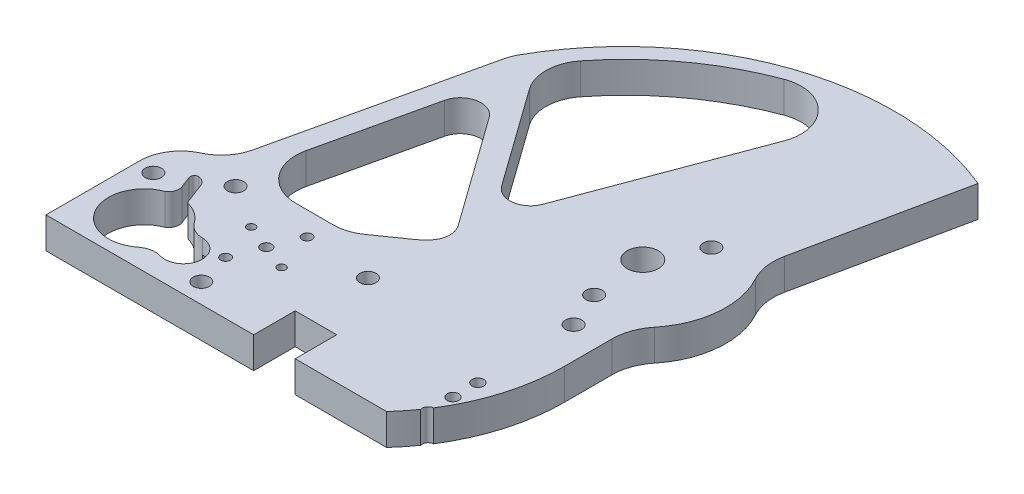
from build123d import *

# Parameters (mm, degrees)
SKETCH1_R                = 4.7625
SKETCH1_W                = 139.7
SKETCH1_H                = 38.1
BOSS_EXTRUDE1_DEPTH      = 9.525
CUT_EXTRUDE4_DEPTH       = 106.62050594
CUT_EXTRUDE4_DEPTH_BACK  = 106.62050594
SKETCH5_W                = 20.32
SKETCH5_H                = 77.381530754
FILLET9_R                = 12.7
BOSS_EXTRUDE4_DEPTH      = 9.525
CUT_EXTRUDE3_DEPTH       = 153.280394257
CUT_EXTRUDE3_DEPTH_BACK  = 153.280394257
SKETCH4_R                = 10.9728
FILLET13_R               = 12.7
FILLET14_R               = 6.35
CUT_EXTRUDE5_DEPTH       = 153.280394397
CUT_EXTRUDE5_DEPTH_BACK  = 153.280394397
SKETCH7_W                = 12.7
SKETCH7_H                = 6.35
FILLET15_R               = 1.27
SKETCH8_W                = 59.69
SKETCH8_H                = 3.175
SKETCH8_W_2              = 12.7
BOSS_EXTRUDE5_DEPTH      = 9.525
SKETCH9_R                = 14.2875
CUT_EXTRUDE6_DEPTH       = 5.08
CUT_EXTRUDE7_DEPTH       = 153.067088129
CUT_EXTRUDE7_DEPTH_BACK  = 153.067088129
SKETCH10_R               = 1.651
BOSS_EXTRUDE6_START      = -9.525
BOSS_EXTRUDE6_DEPTH      = 9.525
FILLET16_R               = 15.24
SKETCH12_R               = 1.5
SKETCH12_R_2             = 1.25
CUT_EXTRUDE8_DEPTH       = 4.445
CUT_EXTRUDE10_DEPTH      = 153.280394397
CUT_EXTRUDE10_DEPTH_BACK = 153.280394397
SKETCH13_R               = 2.4892
SKETCH13_R_2             = 5.715
FILLET18_R               = 6.35
CUT_EXTRUDE11_DEPTH      = 153.280394397
CUT_EXTRUDE11_DEPTH_BACK = 153.280394397
SKETCH15_R               = 2.5
BOSS_EXTRUDE7_DEPTH      = 9.525
CUT_EXTRUDE12_DEPTH      = 153.280394397
CUT_EXTRUDE12_DEPTH_BACK = 153.280394397
SKETCH19_R               = 2.4892
BOSS_EXTRUDE8_DEPTH      = 9.525
SKETCH22_R               = 2.4892
BOSS_EXTRUDE9_DEPTH      = 9.525
CUT_EXTRUDE13_DEPTH      = 153.280394397
CUT_EXTRUDE13_DEPTH_BACK = 153.280394397
SKETCH23_R               = 2.4892
BOSS_EXTRUDE10_DEPTH     = 9.525
BOSS_EXTRUDE11_START     = -9.525
SKETCH26_R               = 2.4892
BOSS_EXTRUDE11_DEPTH     = 9.525
CUT_EXTRUDE14_DEPTH      = 153.280394397
CUT_EXTRUDE14_DEPTH_BACK = 153.280394397
SKETCH25_R               = 2.4892
SKETCH27_W               = 46.99
SKETCH27_H               = 3.175
BOSS_EXTRUDE12_DEPTH     = 9.525
CUT_EXTRUDE15_DEPTH      = 153.280394397
CUT_EXTRUDE15_DEPTH_BACK = 153.280394397
SKETCH28_R               = 1.778
CUT_EXTRUDE16_DEPTH      = 153.280394397
CUT_EXTRUDE16_DEPTH_BACK = 153.280394397
SKETCH29_W               = 12.7
SKETCH29_H               = 12.7
CUT_EXTRUDE17_DEPTH      = 153.280394397
CUT_EXTRUDE17_DEPTH_BACK = 153.280394397


with BuildPart() as part:
    # Sketch1 → Boss-Extrude1 (new body)
    # profile 1 of 2: a face of its own
    with BuildSketch(Plane(origin=(0, 0, 0), x_dir=(1, 0, 0), z_dir=(0, 1, 0))):
        with BuildLine():
            Line((-2.585114067, 30.705073187), (-19.230283607, 19.05))
            Line((-19.230283607, 19.05), (65.876676898, 19.05))
            Line((65.876676898, 19.05), (45.762611627, 67.384672451))
            Line((45.762611627, 67.384672451), (47.126806193, 73.586403918))
            ThreePointArc((47.126806193, 73.586403918), (27.684344017, 77.91367928), (13.031924758, 64.421412702))
            Line((13.031924758, 64.421412702), (0.786820794, 49.82826606))
            Line((0.786820794, 49.82826606), (-2.585114067, 30.705073187))
        make_face()
        with Locations(Location((33.265795842, 57.15, 0), (0, 0, 90))):
            Circle(SKETCH1_R, mode=Mode.SUBTRACT)
    # profile 2 of 2: a face of its own
    with BuildSketch(Plane(origin=(0, 0, 0), x_dir=(1, 0, 0), z_dir=(0, 1, 0))):
        Rectangle(SKETCH1_W, SKETCH1_H)
    extrude(amount=BOSS_EXTRUDE1_DEPTH)

    # Sketch5 → Cut-Extrude4 (cut, two sides: drawn at the far end of the back side and taken through both)
    with BuildSketch(Plane(origin=(0, 9.525, 0), x_dir=(1, 0, 0), z_dir=(0, 1, 0)).offset(-CUT_EXTRUDE4_DEPTH_BACK)):
        with Locations((59.69, 19.640765377)):
            Rectangle(SKETCH5_W, SKETCH5_H)
    extrude(amount=CUT_EXTRUDE4_DEPTH + CUT_EXTRUDE4_DEPTH_BACK, mode=Mode.SUBTRACT)

    # Fillet9
    fillet9_edges = [part.edges().sort_by_distance(p)[0] for p in [
        (-69.85, 4.7625, -19.05),
    ]]
    fillet(fillet9_edges, radius=FILLET9_R)

    # Sketch6 → Boss-Extrude4 (add)
    with BuildSketch(Plane(origin=(0, 9.525, 0), x_dir=(1, 0, 0), z_dir=(0, 1, 0))):
        with BuildLine():
            Line((-40.820324649, 90.757686087), (-57.15, 19.05))
            Line((-57.15, 19.05), (-50.637428899, 19.05))
            Line((-50.637428899, 19.05), (-36.112276852, 82.833573217))
            Line((-36.112276852, 82.833573217), (-1.836902529, 34.948391683))
            Line((-1.836902529, 34.948391683), (-0.1716456, 44.392533029))
            Line((-0.1716456, 44.392533029), (-34.470324649, 92.310272954))
            ThreePointArc((-34.470324649, 92.310272954), (-6.367424053, 120.099806777), (31.427854219, 131.656110351))
            Line((31.427854219, 131.656110351), (0.786820794, 49.82826606))
            Line((0.786820794, 49.82826606), (13.031924758, 64.421412702))
            Line((13.031924758, 64.421412702), (38.768247431, 133.151072535))
            ThreePointArc((38.768247431, 133.151072535), (49.726444557, 129.989338268), (58.105148392, 122.251381827))
            Line((58.105148392, 122.251381827), (46.378042741, 65.905773934))
            Line((46.378042741, 65.905773934), (49.53, 58.331530754))
            Line((49.53, 58.331530754), (64.336089791, 128.600275766))
            ThreePointArc((64.336089791, 128.600275766), (4.413649104, 130.087025535), (-40.820324649, 90.757686087))
        make_face()
    extrude(amount=-BOSS_EXTRUDE4_DEPTH)

    # Sketch4 → Cut-Extrude3 (cut, two sides: drawn at the far end of the back side and taken through both)
    with BuildSketch(Plane(origin=(0, 0, 0), x_dir=(-1, 0, 0), z_dir=(0, -1, 0)).offset(-CUT_EXTRUDE3_DEPTH_BACK)):
        with Locations(Location((53.975, -8.0518, 0), (0, 0, 90))):
            Circle(SKETCH4_R)
    extrude(amount=CUT_EXTRUDE3_DEPTH + CUT_EXTRUDE3_DEPTH_BACK, mode=Mode.SUBTRACT)

    # Fillet13
    # the kernel refuses this fillet: 12.7 mm, written as the material it adds along each edge
    with BuildSketch(Plane(origin=(-57.15, 0, -19.05), x_dir=(-0.976607789728772, 0, 0.2150284284486181), z_dir=(0, 1, 0))) as fillet13_piece_1:
        with BuildLine():
            CenterArc((8.192583124, -12.40291893), FILLET13_R, 102.417195144, 52.336673181)
            Line((-3.294362955, -6.986271462), (0, 0))
            ThreePointArc((0, 0), (2.730861041, -0.29708107), (5.461722083, 0))
        make_face()
    extrude(amount=9.525)
    with BuildSketch(Plane(origin=(-50.637428899, 9.525, -19.05), x_dir=(0.22204095655633652, 0, -0.9750373395986162), z_dir=(0, -1, 0))) as fillet13_piece_2:
        with BuildLine():
            CenterArc((FILLET13_R * 1.25332734135, FILLET13_R), FILLET13_R, 167.17106347, 102.82893653)
            Line((FILLET13_R * 0.278290001752, FILLET13_R * 1.22204095656), (0, 0))
            Line((0, 0), (FILLET13_R * 1.25332734135, 0))
        make_face()
    extrude(amount=9.525)
    with BuildSketch(Plane(origin=(-19.230283607, 0, -19.05), x_dir=(0.8191520442889918, 0, -0.5735764363510462), z_dir=(0, 1, 0))) as fillet13_piece_3:
        with BuildLine():
            CenterArc((FILLET13_R * 0.315298788879, FILLET13_R), FILLET13_R, 235, 35)
            Line((-FILLET13_R * 0.258277647472, FILLET13_R * 0.180847955711), (0, 0))
            Line((0, 0), (FILLET13_R * 0.315298788879, 0))
        make_face()
    extrude(amount=9.525)
    with BuildSketch(Plane(origin=(-2.585114067, 0, -30.705073187), x_dir=(0.17364817766692484, 0, -0.9848077530122089), z_dir=(0, 1, 0))) as fillet13_piece_4:
        with BuildLine():
            CenterArc((5.299189821, 12.661322422), FILLET13_R, 225, 40.527239041)
            Line((-3.681066301, 3.681066301), (0, 0))
            Line((0, 0), (4.308778524, 0))
        make_face()
    extrude(amount=9.525)
    with BuildSketch(Plane(origin=(-0.1716456, 9.525, -44.392533029), x_dir=(0.17364817766692364, 0, -0.9848077530122092), z_dir=(0, -1, 0))) as fillet13_piece_5:
        with BuildLine():
            CenterArc((18.211827751, -0.443902553), FILLET13_R, 177.996935086, 46.408641112)
            Line((9.138889548, -9.330510025), (0, 0))
            Line((0, 0), (5.519587975, 0))
        make_face()
    extrude(amount=9.525)
    with BuildSketch(Plane(origin=(-34.470324649, 9.525, -92.310272954), x_dir=(0.582043833980417, 0, 0.8131574111605802), z_dir=(0, -1, 0))) as fillet13_piece_6:
        with BuildLine():
            CenterArc((8.943849896, -12.7), FILLET13_R, 90, 73.823338331)
            ThreePointArc((-3.25332215, -9.161780942), (-1.76154416, -4.532993874), (0, 0))
            Line((0, 0), (8.943849896, 0))
        make_face()
    extrude(amount=9.525)
    with BuildSketch(Plane(origin=(31.427854219, 9.525, -131.656110351), x_dir=(-0.35067782252306107, 0, 0.9364961637884506), z_dir=(0, -1, 0))) as fillet13_piece_7:
        with BuildLine():
            CenterArc((22.910577069, 12.7), FILLET13_R, 138.970878113, 131.029121887)
            ThreePointArc((13.330001541, 21.036820291), (5.867776411, 11.023572133), (0, 0))
            Line((0, 0), (22.910577069, 0))
        make_face()
    extrude(amount=9.525)
    with BuildSketch(Plane(origin=(38.768247431, 9.525, -133.151072535), x_dir=(0.9114378000140282, 0, 0.4114378892440367), z_dir=(0, -1, 0))) as fillet13_piece_8:
        with BuildLine():
            CenterArc((13.505287969, 11.815048757), FILLET13_R, 176.233586555, 115.281848771)
            Line((0.83271811, 12.649298827), (0, 0))
            ThreePointArc((0, 0), (9.08151833, -1.725447521), (18.163036659, 0))
        make_face()
    extrude(amount=9.525)
    with BuildSketch(Plane(origin=(58.105148392, 9.525, -122.251381827), x_dir=(-0.20376170284526773, 0, 0.9790205148277521), z_dir=(0, -1, 0))) as fillet13_piece_9:
        with BuildLine():
            CenterArc((6.572505314, 12.7), FILLET13_R, 202.357643181, 67.642356819)
            ThreePointArc((-5.172803851, 7.869087807), (-2.96392391, 3.686376997), (0, 0))
            Line((0, 0), (6.572505314, 0))
        make_face()
    extrude(amount=9.525)
    with BuildSketch(Plane(origin=(46.378042741, 9.525, -65.905773934), x_dir=(-0.3842022467121058, 0, -0.9232489553860163), z_dir=(0, -1, 0))) as fillet13_piece_10:
        with BuildLine():
            CenterArc((12.142765771, -7.083707791), FILLET13_R, 124.351243604, 21.746881653)
            Line((4.976604581, 3.401335546), (0, 0))
            Line((0, 0), (1.601841527, 0))
        make_face()
    extrude(amount=9.525)
    with BuildSketch(Plane(origin=(49.53, 9.525, -58.331530754), x_dir=(0, 0, 1), z_dir=(0, -1, 0))) as fillet13_piece_11:
        with BuildLine():
            CenterArc((FILLET13_R * 0.104209219527, -FILLET13_R), FILLET13_R, 90, 11.898549943)
            Line((-FILLET13_R * 0.101970201439, -FILLET13_R * 0.0214857965414), (0, 0))
            Line((0, 0), (FILLET13_R * 0.104209219527, 0))
        make_face()
    extrude(amount=9.525)
    # the kernel refuses this fillet: 12.7 mm, written as the material it takes off along each edge
    with BuildSketch(Plane(origin=(47.126806193, -37.591362954, -73.586403918), x_dir=(-0.21483378988048846, 0, 0.9766506246993272), z_dir=(0, 1, 0))) as fillet13_2_piece_1:
        with BuildLine():
            CenterArc((10.462171267, -12.015824877), FILLET13_R, 108.892466087, 84.306815738)
            ThreePointArc((-1.902317149, -14.915725945), (-2.297569948, -7.286144783), (0, 0))
            Line((0, 0), (6.35, 0))
        make_face()
    extrude(amount=84.707725907, mode=Mode.SUBTRACT)
    with BuildSketch(Plane(origin=(-40.820324649, 14.244767821, -90.757686087), x_dir=(-0.22204095655633999, 0, 0.9750373395986153), z_dir=(0, -1, 0))) as fillet13_2_piece_2:
        with BuildLine():
            CenterArc((1.737149391, -12.7), FILLET13_R, 90, 16.257709838)
            ThreePointArc((-1.818319721, -0.50784517), (-0.91060685, -0.248741695), (0, 0))
            Line((0, 0), (1.737149391, 0))
        make_face()
    extrude(amount=18.964535642, mode=Mode.SUBTRACT)

    # Fillet14
    fillet14_edges = [part.edges().sort_by_distance(p)[0] for p in [
        (0.786820794, 4.7625, -49.82826606),
        (-1.836902529, 4.7625, -34.948391683),
        (-36.112276852, 4.7625, -82.833573217),
        (13.23245619, 4.7625, -64.956938204),
        (45.762611627, 4.7625, -67.384672451),
    ]]
    fillet(fillet14_edges, radius=FILLET14_R)

    # Sketch7 → Cut-Extrude5 (cut, two sides: drawn at the far end of the back side and taken through both)
    with BuildSketch(Plane(origin=(0, 0, 0), x_dir=(-1, 0, 0), z_dir=(0, -1, 0)).offset(-CUT_EXTRUDE5_DEPTH_BACK)):
        with Locations((10.16, -15.875)):
            Rectangle(SKETCH7_W, SKETCH7_H)
    extrude(amount=CUT_EXTRUDE5_DEPTH + CUT_EXTRUDE5_DEPTH_BACK, mode=Mode.SUBTRACT)

    # Fillet15
    fillet15_edges = [part.edges().sort_by_distance(p)[0] for p in [
        (-3.81, 4.7625, 19.05),
    ]]
    fillet(fillet15_edges, radius=FILLET15_R)

    # Sketch8 → Boss-Extrude5 (add)
    with BuildSketch(Plane(origin=(0, 9.525, 0), x_dir=(1, 0, 0), z_dir=(0, 1, 0))):
        with Locations((-40.005, -20.6375)):
            Rectangle(SKETCH8_W, SKETCH8_H)
        with Locations((8.89, -20.6375)):
            Rectangle(SKETCH8_W_2, SKETCH8_H)
    extrude(amount=-BOSS_EXTRUDE5_DEPTH)

    # Sketch9 → Cut-Extrude6 (cut)
    with BuildSketch(Plane.XZ):
        with Locations(Location((-27.615671871, -2.921, 0), (0, 0, 270))):
            Circle(SKETCH9_R)
    extrude(amount=-CUT_EXTRUDE6_DEPTH, mode=Mode.SUBTRACT)

    # Sketch10 → Cut-Extrude7 (cut, two sides: drawn at the far end of the back side and taken through both)
    with BuildSketch(Plane(origin=(0, 5.08, 0), x_dir=(-1, 0, 0), z_dir=(0, -1, 0)).offset(-CUT_EXTRUDE7_DEPTH_BACK)):
        with Locations(Location((27.615671871, 2.921, 0), (0, 0, 90))):
            Circle(SKETCH10_R)
    extrude(amount=CUT_EXTRUDE7_DEPTH + CUT_EXTRUDE7_DEPTH_BACK, mode=Mode.SUBTRACT)

    # Sketch11 → Boss-Extrude6 (add)
    with BuildSketch(Plane(origin=(0, 9.525, 0), x_dir=(1, 0, 0), z_dir=(0, 1, 0)).offset(BOSS_EXTRUDE6_START)):
        with BuildLine():
            ThreePointArc((58.665795842, 57.15), (57.133538631, 65.838547299), (52.721634096, 73.478819853))
            Line((52.721634096, 73.478819853), (49.802869616, 59.626552312))
            ThreePointArc((49.802869616, 59.626552312), (49.598401608, 58.324402676), (49.53, 57.008073666))
            Line((49.53, 57.008073666), (49.53, 37.640113709))
            ThreePointArc((49.53, 37.640113709), (56.268738975, 46.378528086), (58.665795842, 57.15))
        make_face()
    extrude(amount=BOSS_EXTRUDE6_DEPTH)

    # Fillet16
    fillet16_edges = [part.edges().sort_by_distance(p)[0] for p in [
        (49.53, 4.7625, -37.640113709),
        (52.721634096, 4.7625, -73.478819853),
    ]]
    fillet(fillet16_edges, radius=FILLET16_R)

    # Sketch12 → Cut-Extrude8 (cut)
    with BuildSketch(Plane.XZ.offset(-5.08)):
        with Locations(Location((-24.090415029, -11.850309279, 0), (0, 0, 270))):
            Circle(SKETCH12_R)
        with Locations(Location((-35.289297033, -5.950517598, 0), (0, 0, 270))):
            Circle(SKETCH12_R_2)
        with Locations(Location((-31.140928712, 6.008309279, 0), (0, 0, 270))):
            Circle(SKETCH12_R)
        with Locations(Location((-19.942046709, 0.108517598, 0), (0, 0, 270))):
            Circle(SKETCH12_R_2)
    extrude(amount=-CUT_EXTRUDE8_DEPTH, mode=Mode.SUBTRACT)

    # Sketch13 → Cut-Extrude10 (cut, two sides: drawn at the far end of the back side and taken through both)
    with BuildSketch(Plane(origin=(0, 0, 0), x_dir=(-1, 0, 0), z_dir=(0, -1, 0)).offset(-CUT_EXTRUDE10_DEPTH_BACK)):
        with Locations(Location((28.399421405, -16.1925, 0), (0, 0, 90))):
            Circle(SKETCH13_R)
        with Locations(Location((64.5668, 5.3086, 0), (0, 0, 90))):
            Circle(SKETCH13_R)
        with Locations((39.915018784, -10.122382764)):
            Circle(SKETCH13_R_2)
        with BuildLine():
            Line((51.674055679, 3.142720043), (53.974558887, 9.229630913))
            ThreePointArc((53.974558887, 9.229630913), (54.954784391, 10.581337042), (56.485302046, 11.24877034))
            ThreePointArc((56.485302046, 11.24877034), (57.658662148, 10.788019044), (57.856974373, 9.543134332))
            Line((57.856974373, 9.543134332), (56.538847729, 6.055497642))
            ThreePointArc((56.538847729, 6.055497642), (56.592853979, 3.676906453), (58.284268241, 2.003666927))
            Line((58.284268241, 2.003666927), (50.856006778, 2.376783236))
            ThreePointArc((50.856006778, 2.376783236), (51.354082414, 2.664641672), (51.674055679, 3.142720043))
        make_face()
    extrude(amount=CUT_EXTRUDE10_DEPTH + CUT_EXTRUDE10_DEPTH_BACK, mode=Mode.SUBTRACT)

    # Fillet18
    fillet18_edges = [part.edges().sort_by_distance(p)[0] for p in [
        (-43.299001495, 4.7625, 5.516963563),
        (-44.483000869, 4.7625, 13.556733455),
    ]]
    fillet(fillet18_edges, radius=FILLET18_R)

    # Sketch15 → Cut-Extrude11 (cut, two sides: drawn at the far end of the back side and taken through both)
    with BuildSketch(Plane(origin=(0, 9.525, 0), x_dir=(1, 0, 0), z_dir=(0, 1, 0)).offset(-CUT_EXTRUDE11_DEPTH_BACK)):
        with Locations(Location((40.5384, 70.866, 0), (0, 0, 270))):
            Circle(SKETCH15_R)
        with Locations(Location((35.179, 40.386, 0), (0, 0, 270))):
            Circle(SKETCH15_R)
        with Locations(Location((39.9034, 29.3624, 0), (0, 0, 270))):
            Circle(SKETCH15_R)
    extrude(amount=CUT_EXTRUDE11_DEPTH + CUT_EXTRUDE11_DEPTH_BACK, mode=Mode.SUBTRACT)

    # Sketch16 → Boss-Extrude7 (add)
    with BuildSketch(Plane(origin=(0, 9.525, 0), x_dir=(1, 0, 0), z_dir=(0, 1, 0))):
        Polygon((55.88, -6.35), (49.53, -12.7), (49.53, -19.05), (55.88, -19.05), (55.88, -15.875), (53.680295474, -17.145), (53.680295474, -10.795), (55.88, -12.065), align=None)
    extrude(amount=-BOSS_EXTRUDE7_DEPTH)

    # Sketch19 → Cut-Extrude12 (cut, two sides: drawn at the far end of the back side and taken through both)
    with BuildSketch(Plane(origin=(0, 9.525, 0), x_dir=(-1, 0, 0), z_dir=(0, 1, 0)).offset(-CUT_EXTRUDE12_DEPTH_BACK)):
        with Locations(Location((48.4632, -14.351, 0), (0, 0, 90))):
            Circle(SKETCH19_R)
        with Locations(Location((3.9116, -10.287, 0), (0, 0, 90))):
            Circle(SKETCH19_R)
    extrude(amount=CUT_EXTRUDE12_DEPTH + CUT_EXTRUDE12_DEPTH_BACK, mode=Mode.SUBTRACT)

    # Sketch20 → Boss-Extrude8 (add)
    with BuildSketch(Plane(origin=(0, 9.525, 0), x_dir=(1, 0, 0), z_dir=(0, 1, 0))):
        with BuildLine():
            Line((56.765923517, 115.816764291), (49.477471597, 80.79770108))
            ThreePointArc((49.477471597, 80.79770108), (45.750277632, 76.249973388), (39.888432691, 76.711032933))
            ThreePointArc((39.888432691, 76.711032933), (36.568151291, 78.179584032), (32.968035134, 78.648705083))
            Line((32.968035134, 78.648705083), (28.640469351, 78.147364991))
            ThreePointArc((28.640469351, 78.147364991), (22.478176253, 80.187150695), (21.327682643, 86.575495269))
            Line((21.327682643, 86.575495269), (34.322817384, 121.279411659))
            ThreePointArc((34.322817384, 121.279411659), (42.390819167, 128.935945905), (53.393115193, 127.303569849))
            ThreePointArc((53.393115193, 127.303569849), (56.517930083, 121.9825198), (56.765923517, 115.816764291))
        make_face()
    extrude(amount=-BOSS_EXTRUDE8_DEPTH)

    # Sketch22 → Boss-Extrude9 (add)
    with BuildSketch(Plane(origin=(0, 9.525, 0), x_dir=(1, 0, 0), z_dir=(0, 1, 0))):
        Polygon((62.23, 2.521193519), (49.53, -1.837516354), (49.53, -19.05), (62.23, -19.05), align=None)
        with Locations((54.129270233, -12.673767621)):
            Circle(SKETCH22_R, mode=Mode.SUBTRACT)
    extrude(amount=-BOSS_EXTRUDE9_DEPTH)

    # Sketch23 → Cut-Extrude13 (cut, two sides: drawn at the far end of the back side and taken through both)
    with BuildSketch(Plane(origin=(0, 9.525, 0), x_dir=(1, 0, 0), z_dir=(0, 1, 0)).offset(-CUT_EXTRUDE13_DEPTH_BACK)):
        with Locations(Location((54.129270233, -12.673767621, 0), (0, 0, 270))):
            Circle(SKETCH23_R)
    extrude(amount=CUT_EXTRUDE13_DEPTH + CUT_EXTRUDE13_DEPTH_BACK, mode=Mode.SUBTRACT)

    # Sketch24 → Boss-Extrude10 (add)
    with BuildSketch(Plane(origin=(0, 0, 0), x_dir=(-1, 0, 0), z_dir=(0, -1, 0))):
        Polygon((-62.23, -1.837516354), (-49.53, -1.837516354), (-49.53, 2.521193519), align=None)
    extrude(amount=-BOSS_EXTRUDE10_DEPTH)

    # Sketch26 → Boss-Extrude11 (add)
    with BuildSketch(Plane(origin=(0, 0, 0), x_dir=(-1, 0, 0), z_dir=(0, -1, 0)).offset(BOSS_EXTRUDE11_START)):
        with Locations((-54.129270233, -12.673767621)):
            Circle(SKETCH26_R)
    extrude(amount=BOSS_EXTRUDE11_DEPTH)

    # Sketch25 → Cut-Extrude14 (cut, two sides: drawn at the far end of the back side and taken through both)
    with BuildSketch(Plane(origin=(0, 0, 0), x_dir=(-1, 0, 0), z_dir=(0, -1, 0)).offset(-CUT_EXTRUDE14_DEPTH_BACK)):
        with Locations(Location((-57.630729767, -12.673767621, 0), (0, 0, 90))):
            Circle(SKETCH25_R)
        Polygon((-62.23, -1.837516354), (-55.88, 0.341838583), (-62.23, 2.521193519), align=None)
    extrude(amount=CUT_EXTRUDE14_DEPTH + CUT_EXTRUDE14_DEPTH_BACK, mode=Mode.SUBTRACT)

    # Sketch27 → Boss-Extrude12 (add)
    with BuildSketch(Plane(origin=(0, 9.525, 0), x_dir=(1, 0, 0), z_dir=(0, 1, 0))):
        with BuildLine():
            Line((-16.51, -12.7), (-16.51, -19.05))
            Line((-16.51, -19.05), (-10.16, -19.05))
            Line((-10.16, -19.05), (-10.16, -22.225))
            Line((-10.16, -22.225), (2.54, -22.225))
            Line((2.54, -22.225), (2.54, -19.05))
            Line((2.54, -19.05), (-2.54, -19.05))
            ThreePointArc((-2.54, -19.05), (-3.438025612, -18.678025612), (-3.81, -17.78))
            Line((-3.81, -17.78), (-3.81, -12.7))
            Line((-3.81, -12.7), (-16.51, -12.7))
        make_face()
        with Locations((38.735, -20.6375)):
            Rectangle(SKETCH27_W, SKETCH27_H)
    extrude(amount=-BOSS_EXTRUDE12_DEPTH)

    # Sketch28 → Cut-Extrude15 (cut, two sides: drawn at the far end of the back side and taken through both)
    with BuildSketch(Plane(origin=(0, 9.525, 0), x_dir=(1, 0, 0), z_dir=(0, 1, 0)).offset(-CUT_EXTRUDE15_DEPTH_BACK)):
        with Locations(Location((40.64, -8.255, 0), (0, 0, 270))):
            Circle(SKETCH28_R)
        with Locations(Location((40.64, -15.875, 0), (0, 0, 270))):
            Circle(SKETCH28_R)
        with Locations(Location((40.64, -0.635, 0), (0, 0, 270))):
            Circle(SKETCH28_R)
    extrude(amount=CUT_EXTRUDE15_DEPTH + CUT_EXTRUDE15_DEPTH_BACK, mode=Mode.SUBTRACT)

    # Sketch29 → Cut-Extrude16 (cut, two sides: drawn at the far end of the back side and taken through both)
    with BuildSketch(Plane(origin=(0, 9.525, 0), x_dir=(1, 0, 0), z_dir=(0, 1, 0)).offset(-CUT_EXTRUDE16_DEPTH_BACK)):
        with Locations((0, -15.875)):
            Rectangle(SKETCH29_W, SKETCH29_H)
    extrude(amount=CUT_EXTRUDE16_DEPTH + CUT_EXTRUDE16_DEPTH_BACK, mode=Mode.SUBTRACT)

    # Sketch30 → Cut-Extrude17 (cut, two sides: drawn at the far end of the back side and taken through both)
    with BuildSketch(Plane(origin=(0, 9.525, 0), x_dir=(1, 0, 0), z_dir=(0, 1, 0)).offset(-CUT_EXTRUDE17_DEPTH_BACK)):
        with BuildLine():
            Line((34.29, -22.225), (62.23, -22.225))
            Line((62.23, -22.225), (62.23, 16.999176694))
            Line((62.23, 16.999176694), (49.53, 16.999176694))
            ThreePointArc((49.53, 16.999176694), (45.586136967, -4.041222763), (34.29, -22.225))
        make_face()
    extrude(amount=CUT_EXTRUDE17_DEPTH + CUT_EXTRUDE17_DEPTH_BACK, mode=Mode.SUBTRACT)


solid = part.part
